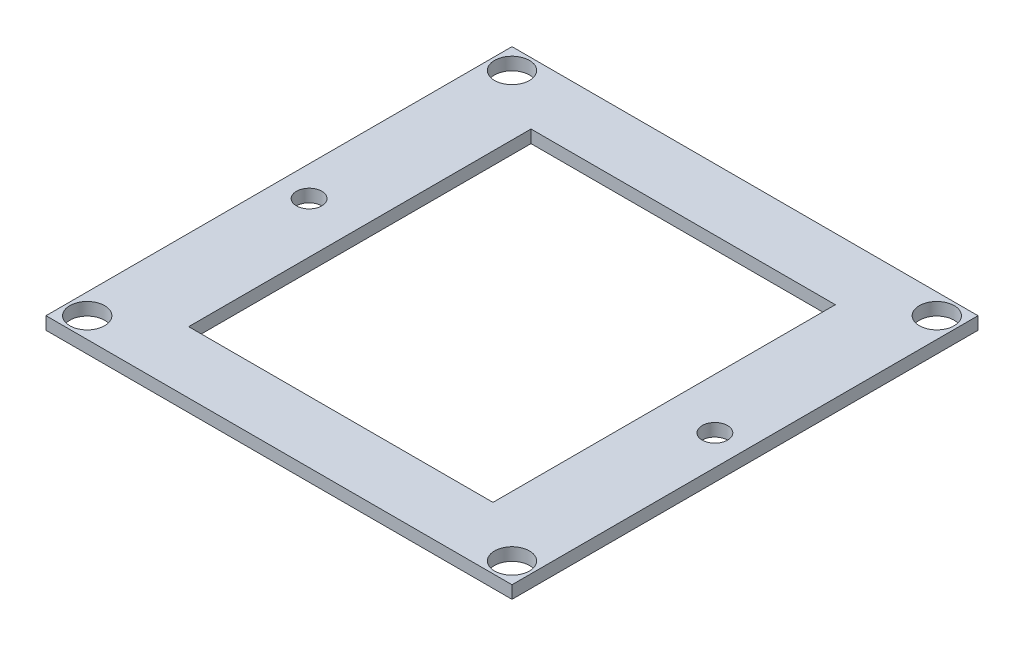
from build123d import *

# Parameters (mm, degrees)
SKETCH1_W               = 294
SKETCH1_H               = 294
SKETCH1_W_2             = 192
SKETCH1_H_2             = 216
BOSS_EXTRUDE1_DEPTH     = 8
SKETCH2_R               = 11
CUT_EXTRUDE1_DEPTH      = 209.043264731
SKETCH4_R               = 8
CUT_EXTRUDE2_DEPTH      = 209.043264731
MIRROR3_COPY_1_SKETCH_R = 11
MIRROR3_COPY_1_DEPTH    = 209.043264731


with BuildPart() as part:
    # Sketch1 → Boss-Extrude1 (new body)
    with BuildSketch(Plane(origin=(0, 0, 0), x_dir=(1, 0, 0), z_dir=(0, 1, 0))):
        Rectangle(SKETCH1_W, SKETCH1_H)
        Rectangle(SKETCH1_W_2, SKETCH1_H_2, mode=Mode.SUBTRACT)
    extrude(amount=BOSS_EXTRUDE1_DEPTH)

    # Sketch2 → Cut-Extrude1 (cut, through all)
    with BuildSketch(Plane(origin=(0, 0, 0), x_dir=(1, 0, 0), z_dir=(0, 1, 0))):
        with Locations((134, 134)):
            Circle(SKETCH2_R)
    cut_extrude1 = extrude(amount=CUT_EXTRUDE1_DEPTH, mode=Mode.SUBTRACT)

    # Mirror2: Cut-Extrude1 across plane
    add(cut_extrude1.mirror(Plane.XY), mode=Mode.SUBTRACT)

    # Sketch4 → Cut-Extrude2 (cut, through all)
    with BuildSketch(Plane(origin=(0, 8, 0), x_dir=(1, 0, 0), z_dir=(0, 1, 0))):
        with Locations((128, 0)):
            Circle(SKETCH4_R)
    cut_extrude2 = extrude(amount=-CUT_EXTRUDE2_DEPTH, mode=Mode.SUBTRACT)

    # Mirror3: Cut-Extrude1 across plane
    add(cut_extrude1.mirror(Plane(origin=(0, 0, 0), x_dir=(0, 0, 1), z_dir=(1, 0, 0))), mode=Mode.SUBTRACT)

    # Mirror3 copy 1 sketch → Mirror3 copy 1 (cut, through all)
    with BuildSketch(Plane(origin=(0, 0, 0), x_dir=(-1, 0, 0), z_dir=(0, 1, 0))):
        with Locations((134, 134)):
            Circle(MIRROR3_COPY_1_SKETCH_R)
    extrude(amount=MIRROR3_COPY_1_DEPTH, mode=Mode.SUBTRACT)

    # Mirror4: Cut-Extrude2 across plane
    add(cut_extrude2.mirror(Plane(origin=(0, 0, 0), x_dir=(0, 0, 1), z_dir=(1, 0, 0))), mode=Mode.SUBTRACT)


solid = part.part
